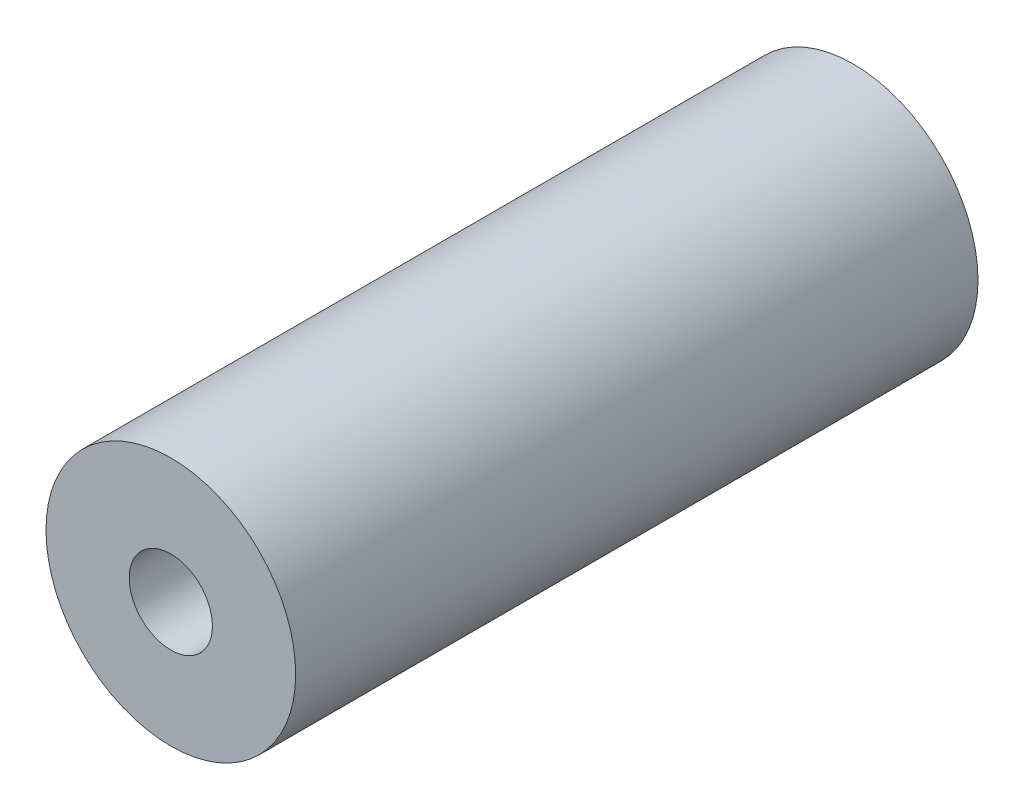
from build123d import *

# Parameters (mm, degrees)
SKETCH1_R           = 9.525
SKETCH1_R_2         = 3.175
BOSS_EXTRUDE1_DEPTH = 52.07


with BuildPart() as part:
    # Sketch1 → Boss-Extrude1 (new body)
    with BuildSketch(Plane.XY):
        Circle(SKETCH1_R)
        Circle(SKETCH1_R_2, mode=Mode.SUBTRACT)
    extrude(amount=BOSS_EXTRUDE1_DEPTH)


solid = part.part
